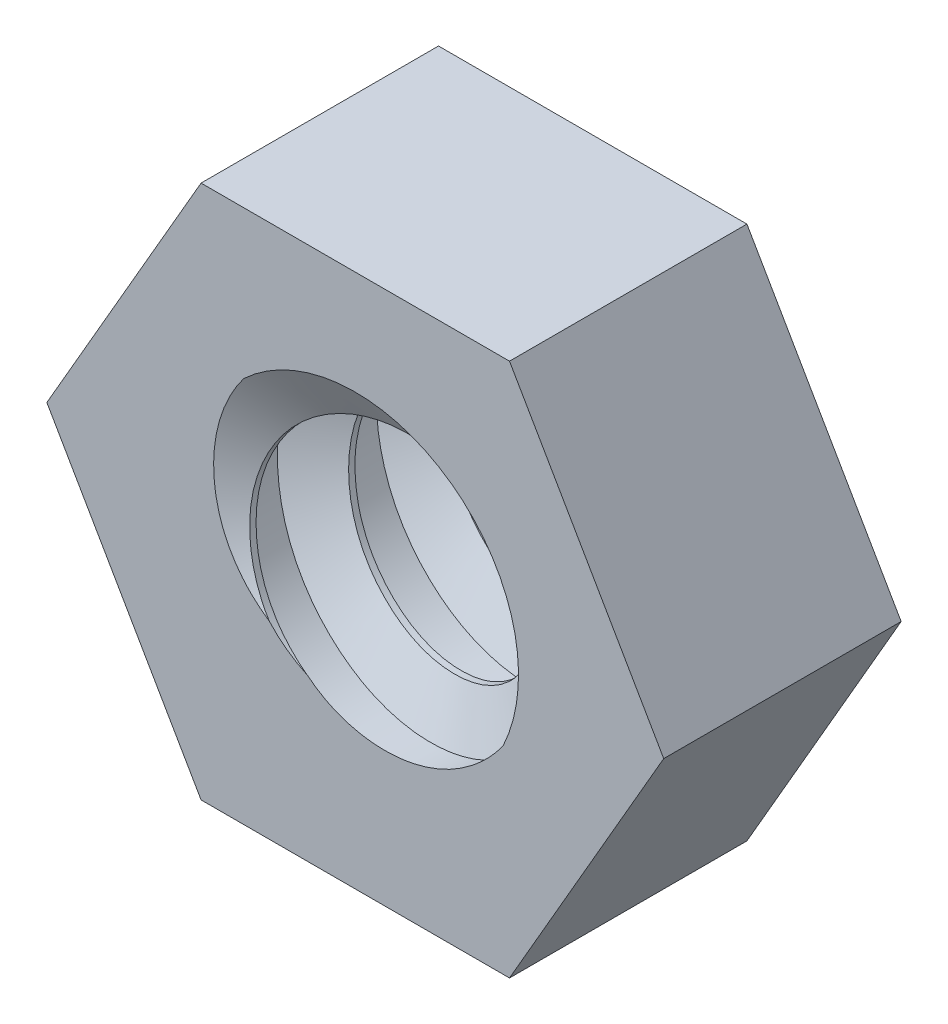
from build123d import *

# Parameters (mm, degrees)
SKETCH1_R                       = 1.175
PRINTED_NUT_AF5P4_H2P4_DEPTH    = 2.4
ACTUAL_MATCHING_FEMALE_P1_PITCH = 1


with BuildPart() as part:
    # Sketch1 → Printed_nut_AF5p4_H2p4 (new body)
    with BuildSketch(Plane.XY):
        Polygon((3.117691454, 0), (1.558845727, 2.7), (-1.558845727, 2.7), (-3.117691454, 0), (-1.558845727, -2.7), (1.558845727, -2.7), align=None)
        Circle(SKETCH1_R, mode=Mode.SUBTRACT)
    extrude(amount=PRINTED_NUT_AF5P4_H2P4_DEPTH)

    # Actual_matching_female_P1: the profile of 3DSketch1 screwed along a right-hand helix of 3 turns, 8 arcs to a turn; built about Z, then put on its axis
    actual_matching_female_p1_z = Axis((0, 0, 0), (0, 0, 1))
    actual_matching_female_p1_corners = [(1.075, 0, -0.52), (1.65, 0, -0.22), (1.65, 0, 0.22), (1.075, 0, 0.52)]
    with BuildLine(mode=Mode.PRIVATE) as actual_matching_female_p1_profile:
        Line(actual_matching_female_p1_corners[0], actual_matching_female_p1_corners[1])
        Line(actual_matching_female_p1_corners[1], actual_matching_female_p1_corners[2])
        Line(actual_matching_female_p1_corners[2], actual_matching_female_p1_corners[3])
        Line(actual_matching_female_p1_corners[3], actual_matching_female_p1_corners[0])
    actual_matching_female_p1_cap = Face(actual_matching_female_p1_profile.wire())
    actual_matching_female_p1_turn_angles = [0, 22.5, 45, 67.5, 90, 112.5, 135, 157.5, 180, 202.5, 225, 247.5, 270, 292.5, 315, 337.5, 360]
    actual_matching_female_p1_turn_weights = [1, 0.9238795325112867, 1, 0.9238795325112867, 1, 0.9238795325112867, 1, 0.9238795325112867, 1, 0.9238795325112867, 1, 0.9238795325112867, 1, 0.9238795325112867, 1, 0.9238795325112867, 1]
    actual_matching_female_p1_turn_rails = [Edge.make_bspline([Vector(p[0], p[1], 0).rotate(actual_matching_female_p1_z, actual_matching_female_p1_turn_angles[k]) / actual_matching_female_p1_turn_weights[k] + Vector(0, 0, p[2] + ACTUAL_MATCHING_FEMALE_P1_PITCH * actual_matching_female_p1_turn_angles[k] / 360) for k in range(17)], [0, 0, 0, 1, 1, 2, 2, 3, 3, 4, 4, 5, 5, 6, 6, 7, 7, 8, 8, 8], 2, actual_matching_female_p1_turn_weights) for p in actual_matching_female_p1_corners]
    actual_matching_female_p1_turn_sides = [Face.make_surface_from_curves(actual_matching_female_p1_turn_rails[p[0]], actual_matching_female_p1_turn_rails[p[1]]) for p in [(0, 1), (1, 2), (2, 3), (3, 0)]]
    actual_matching_female_p1 = Plane(origin=(0, 0, 0.25005), x_dir=(1, 0, 0), z_dir=(0, 0, 1)) * Solid(Shell([*[p.moved(Location((0, 0, ACTUAL_MATCHING_FEMALE_P1_PITCH * i))) for i in range(3) for p in actual_matching_female_p1_turn_sides], actual_matching_female_p1_cap, actual_matching_female_p1_cap.rotate(actual_matching_female_p1_z, 1080).moved(Location((0, 0, ACTUAL_MATCHING_FEMALE_P1_PITCH * 1080 / 360)))]))
    add(actual_matching_female_p1, mode=Mode.SUBTRACT)


solid = part.part
